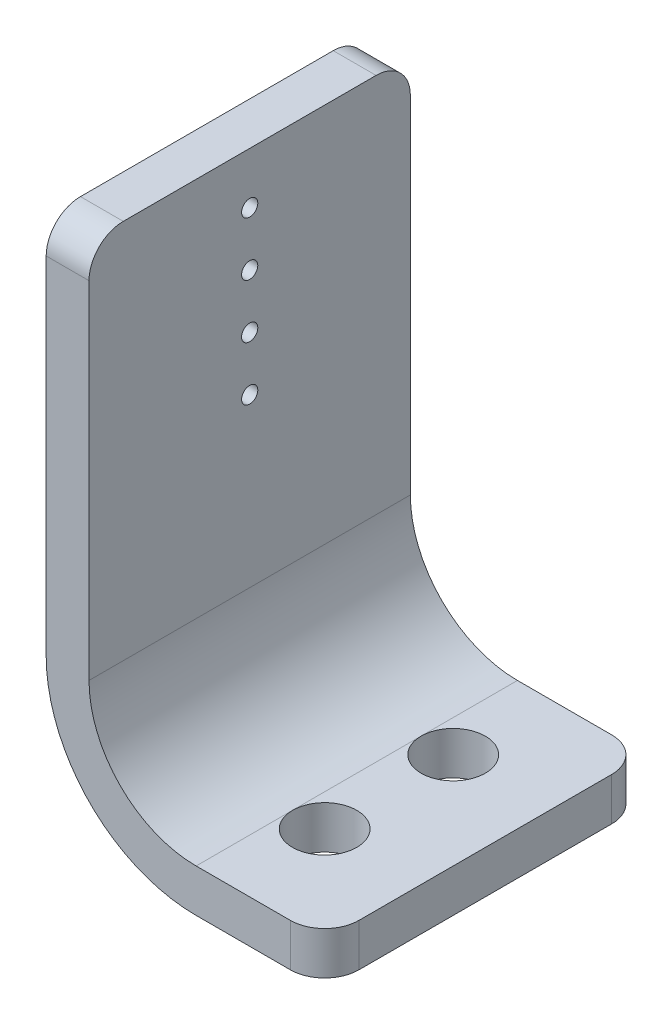
from build123d import *

# Parameters (mm, degrees)
BOSS_EXTRUDE1_DEPTH = 23.8125
CUT_EXTRUDE1_REACH  = 39.985
SKETCH2_R           = 0.6
CUT_EXTRUDE2_REACH  = 48.663
SKETCH5_R           = 2.38125
FILLET1_R           = 2.54


with BuildPart() as part:
    # Sketch1 → Boss-Extrude1 (new body)
    with BuildSketch(Plane.XY):
        with BuildLine():
            Line((0, 18.09564968), (0, -10.09835032))
            ThreePointArc((0, -10.09835032), (2.324839924, -15.711010396), (7.9375, -18.03585032))
            Line((7.9375, -18.03585032), (17.4625, -18.03585032))
            Line((17.4625, -18.03585032), (17.4625, -21.21085032))
            Line((17.4625, -21.21085032), (7.9375, -21.21085032))
            ThreePointArc((7.9375, -21.21085032), (0.079775894, -17.956074426), (-3.175, -10.09835032))
            Line((-3.175, -10.09835032), (-3.175, 18.09564968))
            Line((-3.175, 18.09564968), (0, 18.09564968))
        make_face()
    extrude(amount=BOSS_EXTRUDE1_DEPTH)

    # Sketch2 → Cut-Extrude1 (cut, up to next)
    with BuildSketch(Plane.ZY.offset(3.175), mode=Mode.PRIVATE) as cut_extrude1_sk1:
        with Locations((11.90625, 14.28564968)):
            Circle(SKETCH2_R)
    cut_extrude1_tool1 = extrude(cut_extrude1_sk1.sketch, amount=-CUT_EXTRUDE1_REACH, mode=Mode.PRIVATE) & part.part
    # Sketch2 → Cut-Extrude1 (cut, up to next)
    with BuildSketch(Plane.ZY.offset(3.175), mode=Mode.PRIVATE) as cut_extrude1_sk2:
        with Locations((11.90625, 10.28564968)):
            Circle(SKETCH2_R)
    cut_extrude1_tool2 = extrude(cut_extrude1_sk2.sketch, amount=-CUT_EXTRUDE1_REACH, mode=Mode.PRIVATE) & part.part
    # Sketch2 → Cut-Extrude1 (cut, up to next)
    with BuildSketch(Plane.ZY.offset(3.175), mode=Mode.PRIVATE) as cut_extrude1_sk3:
        with Locations((11.90625, 6.28565768)):
            Circle(SKETCH2_R)
    cut_extrude1_tool3 = extrude(cut_extrude1_sk3.sketch, amount=-CUT_EXTRUDE1_REACH, mode=Mode.PRIVATE) & part.part
    # Sketch2 → Cut-Extrude1 (cut, up to next)
    with BuildSketch(Plane.ZY.offset(3.175), mode=Mode.PRIVATE) as cut_extrude1_sk4:
        with Locations((11.90625, 2.28566568)):
            Circle(SKETCH2_R)
    cut_extrude1_tool4 = extrude(cut_extrude1_sk4.sketch, amount=-CUT_EXTRUDE1_REACH, mode=Mode.PRIVATE) & part.part
    add(cut_extrude1_tool1.solids().sort_by_distance((-3.175, 14.28565, 11.90625))[0], mode=Mode.SUBTRACT)
    add(cut_extrude1_tool2.solids().sort_by_distance((-3.175, 10.28565, 11.90625))[0], mode=Mode.SUBTRACT)
    add(cut_extrude1_tool3.solids().sort_by_distance((-3.175, 6.285658, 11.90625))[0], mode=Mode.SUBTRACT)
    add(cut_extrude1_tool4.solids().sort_by_distance((-3.175, 2.285666, 11.90625))[0], mode=Mode.SUBTRACT)

    # Sketch5 → Cut-Extrude2 (cut, up to next)
    with BuildSketch(Plane(origin=(0, -18.03585032, 0), x_dir=(1, 0, 0), z_dir=(0, 1, 0)), mode=Mode.PRIVATE) as cut_extrude2_sk1:
        with Locations((10.31875, -7.14375)):
            Circle(SKETCH5_R)
    cut_extrude2_tool1 = extrude(cut_extrude2_sk1.sketch, amount=-CUT_EXTRUDE2_REACH, mode=Mode.PRIVATE) & part.part
    # Sketch5 → Cut-Extrude2 (cut, up to next)
    with BuildSketch(Plane(origin=(0, -18.03585032, 0), x_dir=(1, 0, 0), z_dir=(0, 1, 0)), mode=Mode.PRIVATE) as cut_extrude2_sk2:
        with Locations((10.31875, -16.66875)):
            Circle(SKETCH5_R)
    cut_extrude2_tool2 = extrude(cut_extrude2_sk2.sketch, amount=-CUT_EXTRUDE2_REACH, mode=Mode.PRIVATE) & part.part
    add(cut_extrude2_tool1.solids().sort_by_distance((10.31875, -18.03585, 7.14375))[0], mode=Mode.SUBTRACT)
    add(cut_extrude2_tool2.solids().sort_by_distance((10.31875, -18.03585, 16.66875))[0], mode=Mode.SUBTRACT)

    # Fillet1
    fillet1_edges = [part.edges().sort_by_distance(p)[0] for p in [
        (17.4625, -19.62335032, 0),
        (17.4625, -19.62335032, 23.8125),
        (-1.5875, 18.09564968, 0),
        (-1.5875, 18.09564968, 23.8125),
    ]]
    fillet(fillet1_edges, radius=FILLET1_R)


solid = part.part
